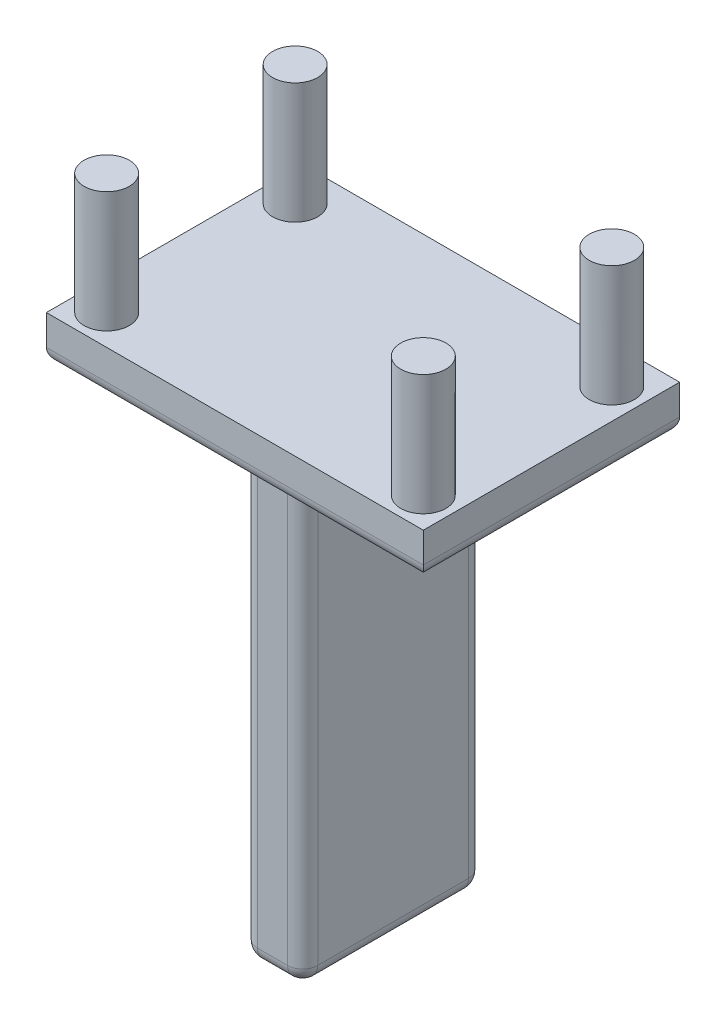
from build123d import *

# Parameters (mm, degrees)
SKETCH1_W           = 25
SKETCH1_H           = 17
BOSS_EXTRUDE1_DEPTH = 3
SKETCH2_R           = 1.5
BOSS_EXTRUDE2_DEPTH = 8
SKETCH3_W           = 4
SKETCH3_H           = 12
BOSS_EXTRUDE3_DEPTH = 30
FILLET1_R           = 1
FILLET2_R           = 1
FILLET3_R           = 1


with BuildPart() as part:
    # Sketch1 → Boss-Extrude1 (new body)
    with BuildSketch(Plane(origin=(0, 0, 0), x_dir=(1, 0, 0), z_dir=(0, 1, 0))):
        Rectangle(SKETCH1_W, SKETCH1_H)
    extrude(amount=BOSS_EXTRUDE1_DEPTH)

    # Sketch2 → Boss-Extrude2 (add)
    with BuildSketch(Plane(origin=(0, 3, 0), x_dir=(1, 0, 0), z_dir=(0, 1, 0))):
        with Locations((-10.5, -6.5)):
            Circle(SKETCH2_R)
        with Locations((10.5, -6.5)):
            Circle(SKETCH2_R)
        with Locations((10.5, 5.999999892)):
            Circle(SKETCH2_R)
        with Locations((-10.5, 5.999999892)):
            Circle(SKETCH2_R)
    extrude(amount=BOSS_EXTRUDE2_DEPTH)

    # Sketch3 → Boss-Extrude3 (add)
    with BuildSketch(Plane.XZ):
        Rectangle(SKETCH3_W, SKETCH3_H)
    extrude(amount=BOSS_EXTRUDE3_DEPTH)

    # Fillet1
    fillet1_edges = [part.edges().sort_by_distance(p)[0] for p in [
        (2, -15, -6),
        (-2, -15, -6),
        (-2, -15, 6),
        (2, -15, 6),
    ]]
    fillet(fillet1_edges, radius=FILLET1_R)

    # Fillet2
    fillet2_edges = [part.edges().sort_by_distance(p)[0] for p in [
        (-1.707106781, -30, -5.707106781),
        (-2, -30, 0),
        (-1.707106781, -30, 5.707106781),
        (0, -30, 6),
        (1.707106781, -30, 5.707106781),
        (2, -30, 0),
        (1.707106781, -30, -5.707106781),
        (0, -30, -6),
    ]]
    fillet(fillet2_edges, radius=FILLET2_R)

    # Fillet3
    fillet3_edges = [part.edges().sort_by_distance(p)[0] for p in [
        (0, 0, -8.5),
        (-12.5, 0, 0),
        (0, 0, 8.5),
        (12.5, 0, 0),
        (1.707106781, 0, 5.707106781),
        (0, 0, 6),
        (-1.707106781, 0, 5.707106781),
        (-2, 0, 0),
        (-1.707106781, 0, -5.707106781),
        (0, 0, -6),
        (1.707106781, 0, -5.707106781),
        (2, 0, 0),
    ]]
    fillet(fillet3_edges, radius=FILLET3_R)


solid = part.part
